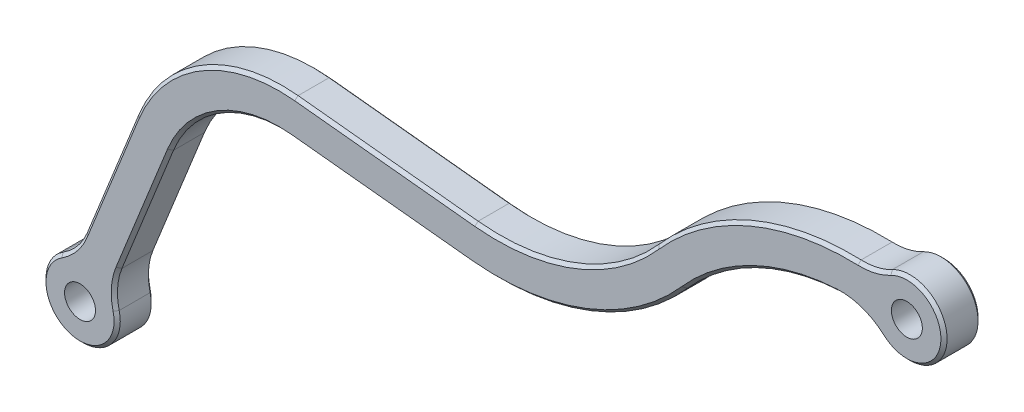
from build123d import *

# Parameters (mm, degrees)
EXTRUDE_THIN1_DEPTH   = 3
SKETCH1_3_R           = 3
BOSS_EXTRUDE1_DEPTH   = 3
FILLET1_R             = 5
F_2_5MM_DOWEL_HOLE1_D = 2.5
CHAMFER1_SIZE         = 0.25


with BuildPart() as part:
    # Sketch1 → Extrude-Thin1 (new body)
    with BuildSketch(Plane.XY):
        with BuildLine():
            ThreePointArc((67.801370449, 34.141342947), (56.598136233, 33.812681852), (47.198138914, 27.708541828))
            ThreePointArc((47.198138914, 27.708541828), (40.574587763, 23.069242721), (32.560988498, 21.984460302))
            Line((32.560988498, 21.984460302), (18.0194176, 23.497567077))
            ThreePointArc((18.0194176, 23.497567077), (10.297542455, 21.776854665), (5.1667157, 15.754992513))
            Line((5.1667157, 15.754992513), (-0.737799909, 1.088733357))
            Line((-0.737799909, 1.088733357), (2.04513605, -0.031653828))
            Line((2.04513605, -0.031653828), (7.949651659, 14.634605328))
            ThreePointArc((7.949651659, 14.634605328), (11.845577871, 19.207110251), (17.7089323, 20.513677186))
            Line((17.7089323, 20.513677186), (32.250503198, 19.000570412))
            ThreePointArc((32.250503198, 19.000570412), (41.667206568, 20.275287791), (49.450477778, 25.726883522))
            ThreePointArc((49.450477778, 25.726883522), (57.492238313, 30.949016112), (67.076680067, 31.230187876))
            Line((67.076680067, 31.230187876), (67.801370449, 34.141342947))
        make_face()
    extrude(amount=EXTRUDE_THIN1_DEPTH)

    # Sketch1<3> → Boss-Extrude1 (add, through all)
    with BuildSketch(Plane.XY):
        with Locations((0.653668071, 0.528539764)):
            Circle(SKETCH1_3_R)
        with Locations((67.439025258, 32.685765412)):
            Circle(SKETCH1_3_R)
    extrude(amount=BOSS_EXTRUDE1_DEPTH)

    # Fillet1
    fillet1_edges = [part.edges().sort_by_distance(p)[0] for p in [
        (0.232483855, 3.498826595, 1.5),
        (3.015419815, 2.37843941, 1.5),
        (64.619351463, 31.661343773, 1.5),
        (65.147115394, 34.621520866, 1.5),
    ]]
    fillet(fillet1_edges, radius=FILLET1_R)

    # Ø2.5mm Dowel Hole1 (through all)
    with Locations(Plane.XY.offset(3)):
        with Locations((67.439025258, 32.685765412), (0.653668071, 0.528539764)):
            Hole(F_2_5MM_DOWEL_HOLE1_D / 2)

    # Chamfer1
    chamfer1_edges = [part.edges().sort_by_distance(p)[0] for p in [
        (10.297542455, 21.776854665, 0),
        (25.290203049, 22.741013689, 0),
        (40.574587763, 23.069242721, 0),
        (41.667206568, 20.275287791, 0),
        (24.979717749, 19.757123799, 0),
        (5.868250185, 9.464600631, 3),
        (11.845577871, 19.207110251, 0),
        (5.868250185, 9.464600631, 0),
        (3.085314225, 10.584987816, 0),
        (11.845577871, 19.207110251, 3),
        (24.979717749, 19.757123799, 3),
        (41.667206568, 20.275287791, 3),
        (40.574587763, 23.069242721, 3),
        (25.290203049, 22.741013689, 3),
        (10.297542455, 21.776854665, 3),
        (3.085314225, 10.584987816, 3),
        (55.029480027, 29.973141473, 0),
        (55.029480027, 29.973141473, 3),
        (70.417176443, 32.324357726, 0),
        (70.417176443, 32.324357726, 3),
        (54.557553661, 33.056070888, 0),
        (54.557553661, 33.056070888, 3),
        (-0.466719115, -2.254396195, 3),
        (-0.466719115, -2.254396195, 0),
        (63.752058153, 31.452795933, 3),
        (63.752058153, 31.452795933, 0),
        (64.7995305, 34.870879047, 3),
        (64.7995305, 34.870879047, 0),
        (3.437869945, 2.784750939, 0),
        (3.437869945, 2.784750939, 3),
        (0.209401135, 4.084505995, 0),
        (0.209401135, 4.084505995, 3),
    ]]
    chamfer(chamfer1_edges, length=CHAMFER1_SIZE - 0.0001)  # a hair under: the kernel refuses the full size


solid = part.part
